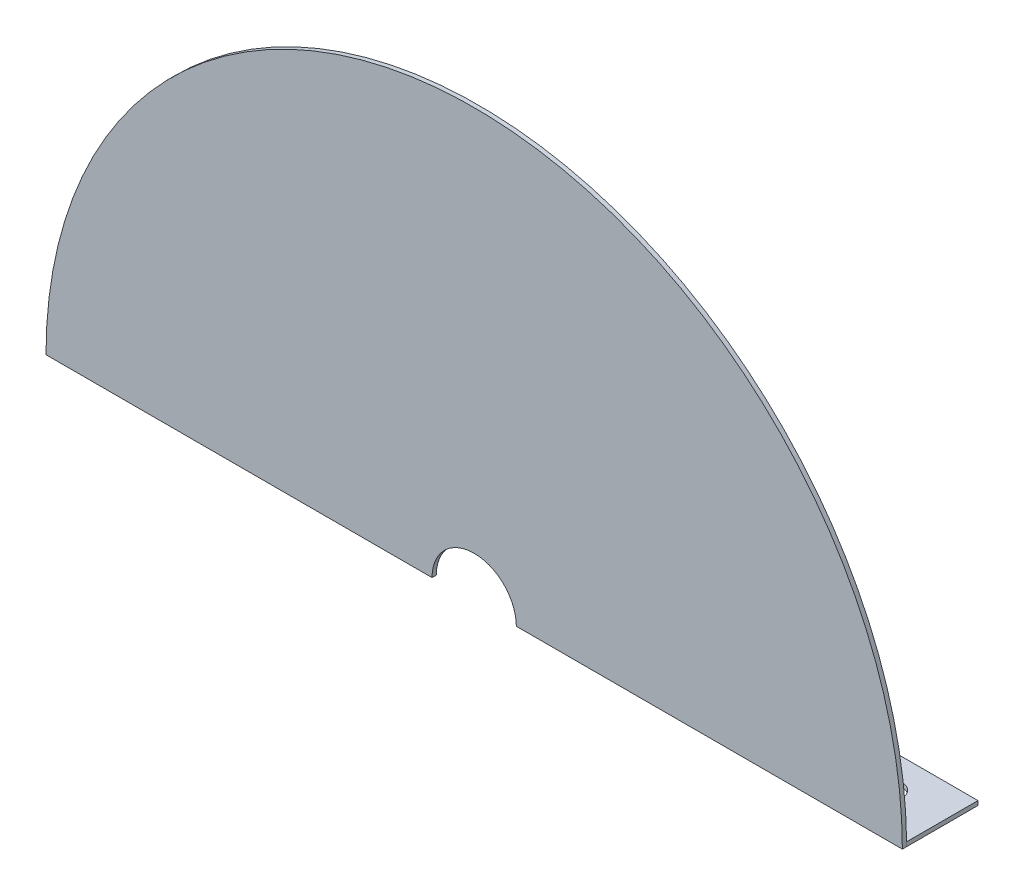
from build123d import *

# Parameters (mm, degrees)
OUTER_CASING_DEPTH  = 1.51892
SKETCH1_R           = 15
INNER_CUTOUT_DEPTH  = 20
SKETCH4_W           = 76.2
SKETCH4_H           = 1.51892
BOSS_EXTRUDE1_DEPTH = 25.4
SKETCH5_R           = 4.7625
CUT_EXTRUDE1_DEPTH  = 216.953745747


with BuildPart() as part:
    # Plate shape → Outer casing (new body)
    with BuildSketch(Plane.XY):
        with BuildLine():
            Line((0, 152.4), (-152.4, 152.4))
            ThreePointArc((-152.4, 152.4), (0, 304.8), (152.4, 152.4))
            Line((152.4, 152.4), (0, 152.4))
        make_face()
    extrude(amount=OUTER_CASING_DEPTH)

    # Sketch1 → Inner Cutout (cut)
    with BuildSketch(Plane.XY.offset(1.51892)):
        with Locations((0, 152.4)):
            Circle(SKETCH1_R)
    extrude(amount=-INNER_CUTOUT_DEPTH, mode=Mode.SUBTRACT)

    # Sketch4 → Boss-Extrude1 (add)
    with BuildSketch(Plane(origin=(0, 0, 0), x_dir=(-1, 0, 0), z_dir=(0, 0, -1))):
        with Locations((-114.3, 153.15946)):
            Rectangle(SKETCH4_W, SKETCH4_H)
        with Locations((114.3, 153.15946)):
            Rectangle(SKETCH4_W, SKETCH4_H)
    extrude(amount=BOSS_EXTRUDE1_DEPTH)

    # Sketch5 → Cut-Extrude1 (cut, through all)
    with BuildSketch(Plane(origin=(0, 153.91892, 0), x_dir=(1, 0, 0), z_dir=(0, 1, 0))):
        with Locations((133.35, 12.7)):
            Circle(SKETCH5_R)
        with Locations((95.25, 12.7)):
            Circle(SKETCH5_R)
        with Locations((-133.35, 12.7)):
            Circle(SKETCH5_R)
        with Locations((-95.25, 12.7)):
            Circle(SKETCH5_R)
    extrude(amount=-CUT_EXTRUDE1_DEPTH, mode=Mode.SUBTRACT)


solid = part.part
